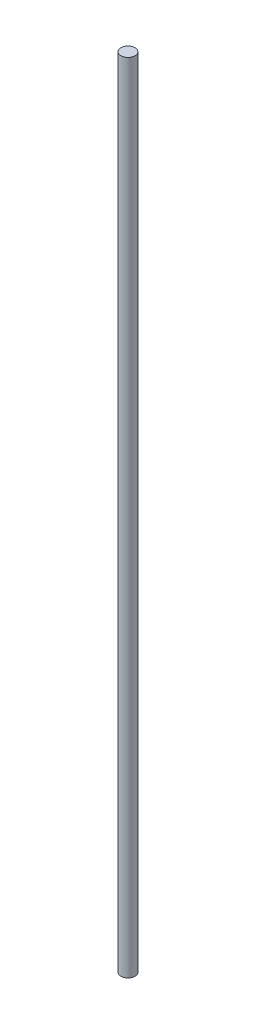
from build123d import *

# Parameters (mm, degrees)
SKETCH1_R           = 4
BOSS_EXTRUDE1_DEPTH = 454.9


with BuildPart() as part:
    # Sketch1 → Boss-Extrude1 (new body)
    with BuildSketch(Plane(origin=(0, 0, 0), x_dir=(1, 0, 0), z_dir=(0, 1, 0))):
        Circle(SKETCH1_R)
    extrude(amount=BOSS_EXTRUDE1_DEPTH)


solid = part.part
